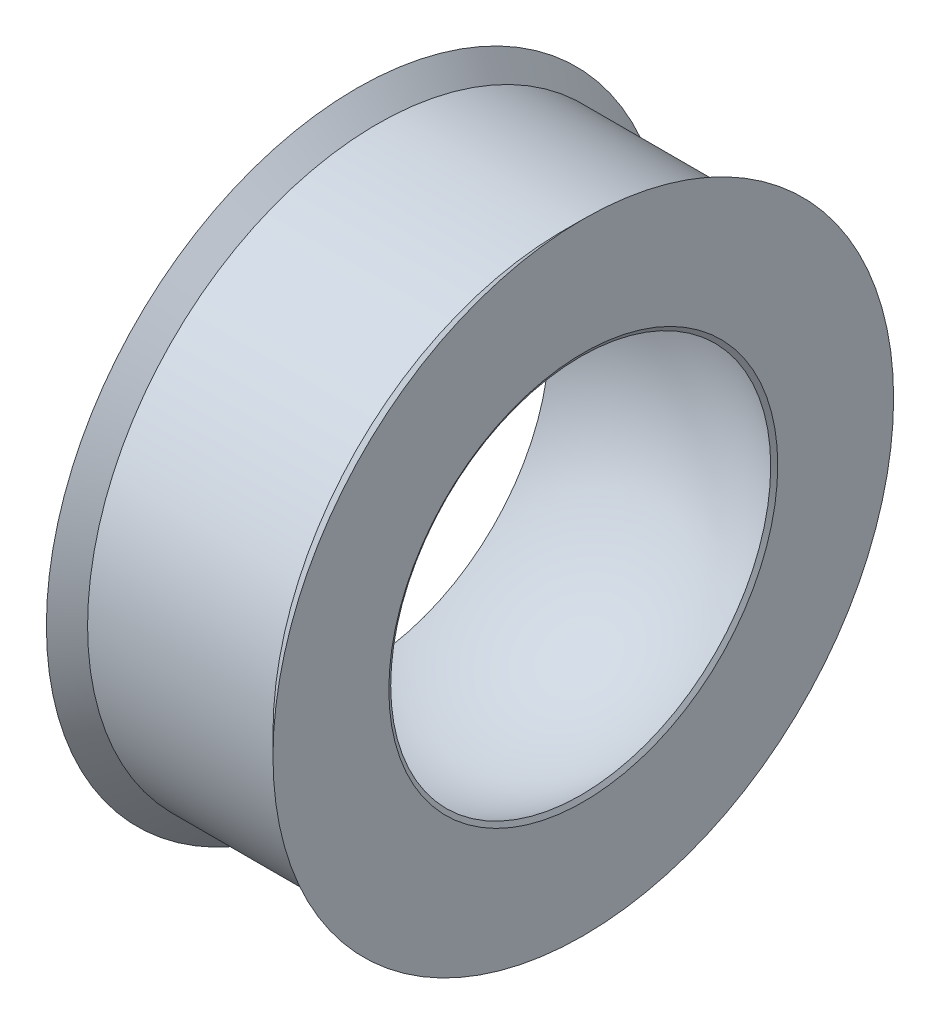
from build123d import *


# Read off the part's stored shape, not the designer's step: Thicken1
with BuildPart() as part:
    # Sketch2 → Revolve1 (revolve)
    with BuildSketch(Plane.XY, mode=Mode.PRIVATE) as revolve1_sk:
        Polygon((2.286, 7.14502), (-2.286, 7.14502), (-2.794, 7.65302), (-2.794, 0), (2.794, 0), (2.794, 7.65302), align=None)
    revolve(revolve1_sk.sketch.rotate(Axis((-5.873222294, 0, 0), (1, 0, 0)), 90), axis=Axis((-5.873222294, 0, 0), (1, 0, 0)))

    # Sketch3 → Cut-Revolve1 (revolve, cut)
    with BuildSketch(Plane(origin=(0, 0, 0), x_dir=(0, 0, -1), z_dir=(1, 0, 0))):
        with BuildLine():
            Line((-5.5499, 0), (5.5499, 0))
            ThreePointArc((5.5499, 0), (0, 5.5499), (-5.5499, 0))
        make_face()
    revolve(axis=Axis((0, 0, 5.5499), (0, 0, -1)), mode=Mode.SUBTRACT)


with BuildPart() as body_2:
    # Thicken1 outline → Thicken1 (revolve)
    with BuildSketch(Plane.YX):
        with BuildLine():
            ThreePointArc((4.685573022, 2.730064078), (5.4229, 0), (4.685573022, -2.730064078))
            Line((4.685573022, -2.730064078), (4.795305412, -2.794000002))
            ThreePointArc((4.795305412, -2.794000002), (5.5499, 0), (4.795305412, 2.794000002))
            Line((4.795305412, 2.794000002), (4.685573022, 2.730064078))
        make_face()
    revolve(axis=Axis((0, 0, 0), (1, 0, 0)))


solid = Compound([part.part, body_2.part])
